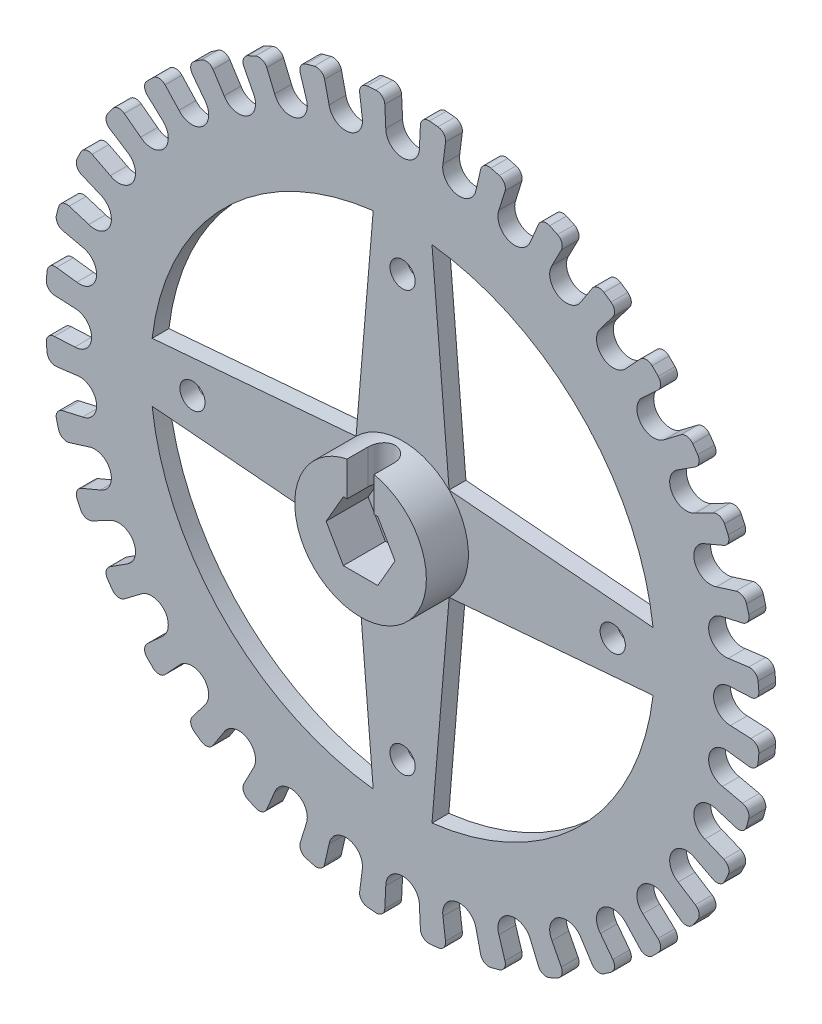
from build123d import *

# Parameters (mm, degrees)
SKETCH1_R                = 42.5
SKETCH1_R_2              = 1.5
BOSS_EXTRUDE1_DEPTH      = 2
CUT_EXTRUDE1_DEPTH       = 61.137342808
FILLET1_R                = 1
CIRPATTERN1_COUNT        = 36
FILLET1_OF_CIRPATTERN1_R = 1
SKETCH6_R                = 7.827729387
BOSS_EXTRUDE2_DEPTH      = 5
CUT_EXTRUDE2_DEPTH       = 5
CUT_EXTRUDE3_DEPTH       = 5


with BuildPart() as part:
    # Sketch1 → Boss-Extrude1 (new body)
    with BuildSketch(Plane.XY):
        Circle(SKETCH1_R)
        with Locations((0, 25)):
            Circle(SKETCH1_R_2, mode=Mode.SUBTRACT)
        with Locations((25, 0)):
            Circle(SKETCH1_R_2, mode=Mode.SUBTRACT)
        with Locations((0, -25)):
            Circle(SKETCH1_R_2, mode=Mode.SUBTRACT)
        with Locations((-25, 0)):
            Circle(SKETCH1_R_2, mode=Mode.SUBTRACT)
        with BuildLine():
            Line((-3.497093615, 29.795475097), (-5.535040531, 5.535040531))
            Line((-5.535040531, 5.535040531), (-29.795475097, 3.497093615))
            ThreePointArc((-29.795475097, 3.497093615), (-21.213203436, 21.213203436), (-3.497093615, 29.795475097))
        make_face(mode=Mode.SUBTRACT)
        Polygon((1.558845727, 0), (0.779422863, 1.35), (-0.779422863, 1.35), (-1.558845727, 0), (-0.779422863, -1.35), (0.779422863, -1.35), align=None, mode=Mode.SUBTRACT)
        with BuildLine():
            Line((3.497093615, 29.795475097), (5.535040531, 5.535040531))
            Line((5.535040531, 5.535040531), (29.795475097, 3.497093615))
            ThreePointArc((29.795475097, 3.497093615), (21.213203436, 21.213203436), (3.497093615, 29.795475097))
        make_face(mode=Mode.SUBTRACT)
        with BuildLine():
            Line((29.795475097, -3.497093615), (5.535040531, -5.535040531))
            Line((5.535040531, -5.535040531), (3.497093615, -29.795475097))
            ThreePointArc((3.497093615, -29.795475097), (21.213203436, -21.213203436), (29.795475097, -3.497093615))
        make_face(mode=Mode.SUBTRACT)
        with BuildLine():
            Line((-3.497093615, -29.795475097), (-5.535040531, -5.535040531))
            Line((-5.535040531, -5.535040531), (-29.795475097, -3.497093615))
            ThreePointArc((-29.795475097, -3.497093615), (-21.213203436, -21.213203436), (-3.497093615, -29.795475097))
        make_face(mode=Mode.SUBTRACT)
    extrude(amount=BOSS_EXTRUDE1_DEPTH)

    # Sketch2 → Cut-Extrude1 (cut, through all)
    with BuildSketch(Plane.XY.offset(2)):
        with BuildLine():
            Line((-2, 39), (-2.25, 44.151660968))
            Line((-2.25, 44.151660968), (2.25, 44.151660968))
            Line((2.25, 44.151660968), (2, 39))
            ThreePointArc((2, 39), (0, 37), (-2, 39))
        make_face()
    cut_extrude1 = extrude(amount=-CUT_EXTRUDE1_DEPTH, mode=Mode.SUBTRACT)

    # Fillet1
    fillet1_edges = [part.edges().sort_by_distance(p)[0] for p in [
        (-2.167165012, 42.444709868, 1),
        (2.167165012, 42.444709868, 1),
    ]]
    fillet(fillet1_edges, radius=FILLET1_R)

    # CirPattern1: Cut-Extrude1 ×36 about axis
    cirpattern1_axis = Axis((0, 0, 2), (0, 0, -1))
    for i in range(1, CIRPATTERN1_COUNT):
        add(cut_extrude1.rotate(cirpattern1_axis, i * 360 / CIRPATTERN1_COUNT), mode=Mode.SUBTRACT)

    # Fillet1 of CirPattern1
    fillet1_of_cirpattern1_edges = [part.edges().sort_by_distance(p)[0] for p in [
        (5.236205614, 42.176203608, 1),
        (9.504687426, 41.423555098, 1),
        (12.480476783, 40.626194743, 1),
        (16.553414722, 39.143766567, 1),
        (19.34553498, 37.841779508, 1),
        (23.099174889, 35.674614496, 1),
        (25.622788885, 33.907560952, 1),
        (28.943078315, 31.121507317, 1),
        (31.121507317, 28.943078315, 1),
        (33.907560952, 25.622788885, 1),
        (35.674614496, 23.099174889, 1),
        (37.841779508, 19.34553498, 1),
        (39.143766567, 16.553414722, 1),
        (40.626194743, 12.480476783, 1),
        (41.423555098, 9.504687426, 1),
        (42.176203608, 5.236205614, 1),
        (42.444709868, 2.167165012, 1),
        (42.444709868, -2.167165012, 1),
        (42.176203608, -5.236205614, 1),
        (41.423555098, -9.504687426, 1),
        (40.626194743, -12.480476783, 1),
        (39.143766567, -16.553414722, 1),
        (37.841779508, -19.34553498, 1),
        (35.674614496, -23.099174889, 1),
        (33.907560952, -25.622788885, 1),
        (31.121507317, -28.943078315, 1),
        (28.943078315, -31.121507317, 1),
        (25.622788885, -33.907560952, 1),
        (23.099174889, -35.674614496, 1),
        (19.34553498, -37.841779508, 1),
        (16.553414722, -39.143766567, 1),
        (12.480476783, -40.626194743, 1),
        (9.504687426, -41.423555098, 1),
        (5.236205614, -42.176203608, 1),
        (2.167165012, -42.444709868, 1),
        (-2.167165012, -42.444709868, 1),
        (-5.236205614, -42.176203608, 1),
        (-9.504687426, -41.423555098, 1),
        (-12.480476783, -40.626194743, 1),
        (-16.553414722, -39.143766567, 1),
        (-19.34553498, -37.841779508, 1),
        (-23.099174889, -35.674614496, 1),
        (-25.622788885, -33.907560952, 1),
        (-28.943078315, -31.121507317, 1),
        (-31.121507317, -28.943078315, 1),
        (-33.907560952, -25.622788885, 1),
        (-35.674614496, -23.099174889, 1),
        (-37.841779508, -19.34553498, 1),
        (-39.143766567, -16.553414722, 1),
        (-40.626194743, -12.480476783, 1),
        (-41.423555098, -9.504687426, 1),
        (-42.176203608, -5.236205614, 1),
        (-42.444709868, -2.167165012, 1),
        (-42.444709868, 2.167165012, 1),
        (-42.176203608, 5.236205614, 1),
        (-41.423555098, 9.504687426, 1),
        (-40.626194743, 12.480476783, 1),
        (-39.143766567, 16.553414722, 1),
        (-37.841779508, 19.34553498, 1),
        (-35.674614496, 23.099174889, 1),
        (-33.907560952, 25.622788885, 1),
        (-31.121507317, 28.943078315, 1),
        (-28.943078315, 31.121507317, 1),
        (-25.622788885, 33.907560952, 1),
        (-23.099174889, 35.674614496, 1),
        (-19.34553498, 37.841779508, 1),
        (-16.553414722, 39.143766567, 1),
        (-12.480476783, 40.626194743, 1),
        (-9.504687426, 41.423555098, 1),
        (-5.236205614, 42.176203608, 1),
    ]]
    fillet(fillet1_of_cirpattern1_edges, radius=FILLET1_OF_CIRPATTERN1_R)

    # Sketch6 → Boss-Extrude2 (add)
    with BuildSketch(Plane.XY.offset(2)):
        Circle(SKETCH6_R)
    extrude(amount=BOSS_EXTRUDE2_DEPTH)

    # Sketch7 → Cut-Extrude2 (cut)
    with BuildSketch(Plane.XY.offset(7)):
        Polygon((4.099186911, 0), (2.049593456, 3.55), (-2.049593456, 3.55), (-4.099186911, 0), (-2.049593456, -3.55), (2.049593456, -3.55), align=None)
    extrude(amount=-CUT_EXTRUDE2_DEPTH, mode=Mode.SUBTRACT)

    # Sketch8 → Cut-Extrude3 (cut)
    with BuildSketch(Plane.XZ.offset(-3.55)):
        with BuildLine():
            Line((1.6, 4.5), (1.6, 7.951889224))
            Line((1.6, 7.951889224), (-1.6, 7.951889224))
            Line((-1.6, 7.951889224), (-1.6, 4.5))
            ThreePointArc((-1.6, 4.5), (0, 2.9), (1.6, 4.5))
        make_face()
    extrude(amount=-CUT_EXTRUDE3_DEPTH, mode=Mode.SUBTRACT)


solid = part.part
